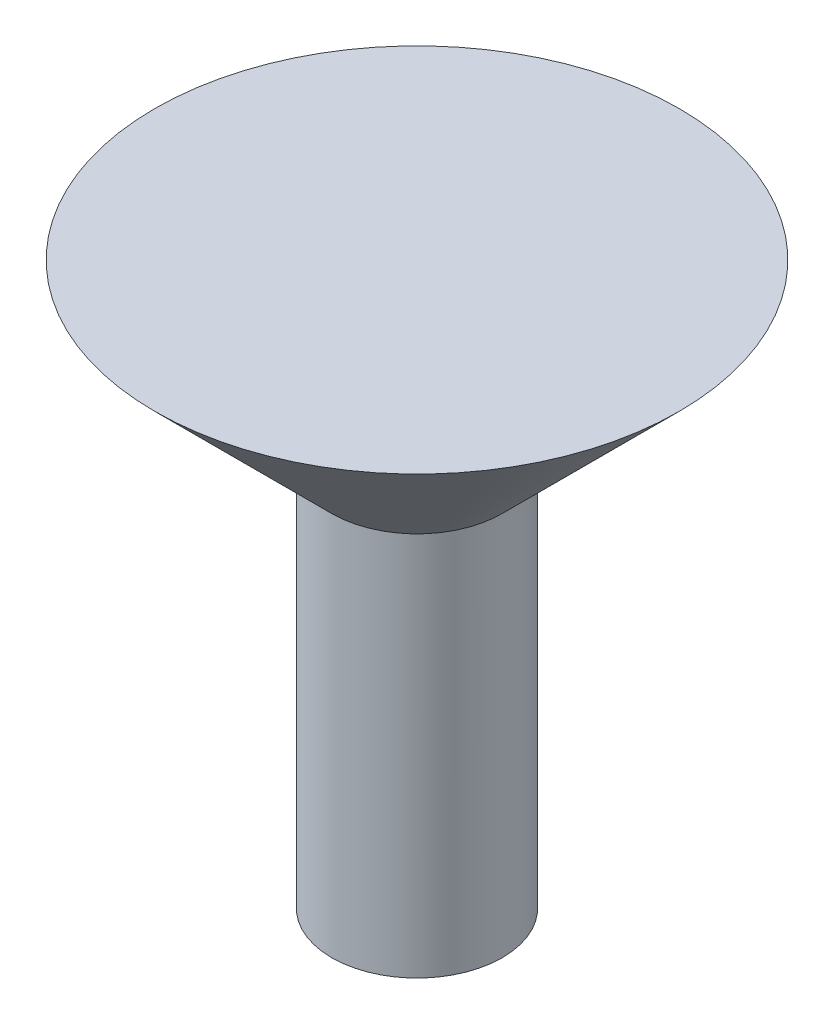
from build123d import *

# Parameters (mm, degrees)
SKETCH2_R           = 2.217157288
BOSS_EXTRUDE1_DEPTH = 10
SKETCH3_R           = 1.7
BOSS_EXTRUDE2_DEPTH = 3
SKETCH3_2_R         = 1.7
CUT_EXTRUDE1_DEPTH  = 3


with BuildPart() as part:
    # Sketch1 → Revolve1 (revolve)
    with BuildSketch(Plane.XY):
        Polygon((-0.2, 2.3), (-0.2, -2.3), (-2.417157288, -2.3), (-7.017157288, 2.3), align=None)
    revolve(axis=Axis((-0.2, 2.3, 0), (0, -1, 0)))

    # Sketch2 → Boss-Extrude1 (add)
    with BuildSketch(Plane.XZ.offset(2.3)):
        with Locations((-0.2, 0)):
            Circle(SKETCH2_R)
    extrude(amount=BOSS_EXTRUDE1_DEPTH)

    # Sketch3 → Boss-Extrude2 (add)
    with BuildSketch(Plane.XZ.offset(12.3)):
        with Locations((-0.2, 0)):
            Circle(SKETCH3_R)
    extrude(amount=-BOSS_EXTRUDE2_DEPTH)

    # Sketch3<2> → Cut-Extrude1 (cut)
    with BuildSketch(Plane.XZ.offset(12.3)):
        with Locations((-0.2, 0)):
            Circle(SKETCH3_2_R)
    extrude(amount=-CUT_EXTRUDE1_DEPTH, mode=Mode.SUBTRACT)


solid = part.part
